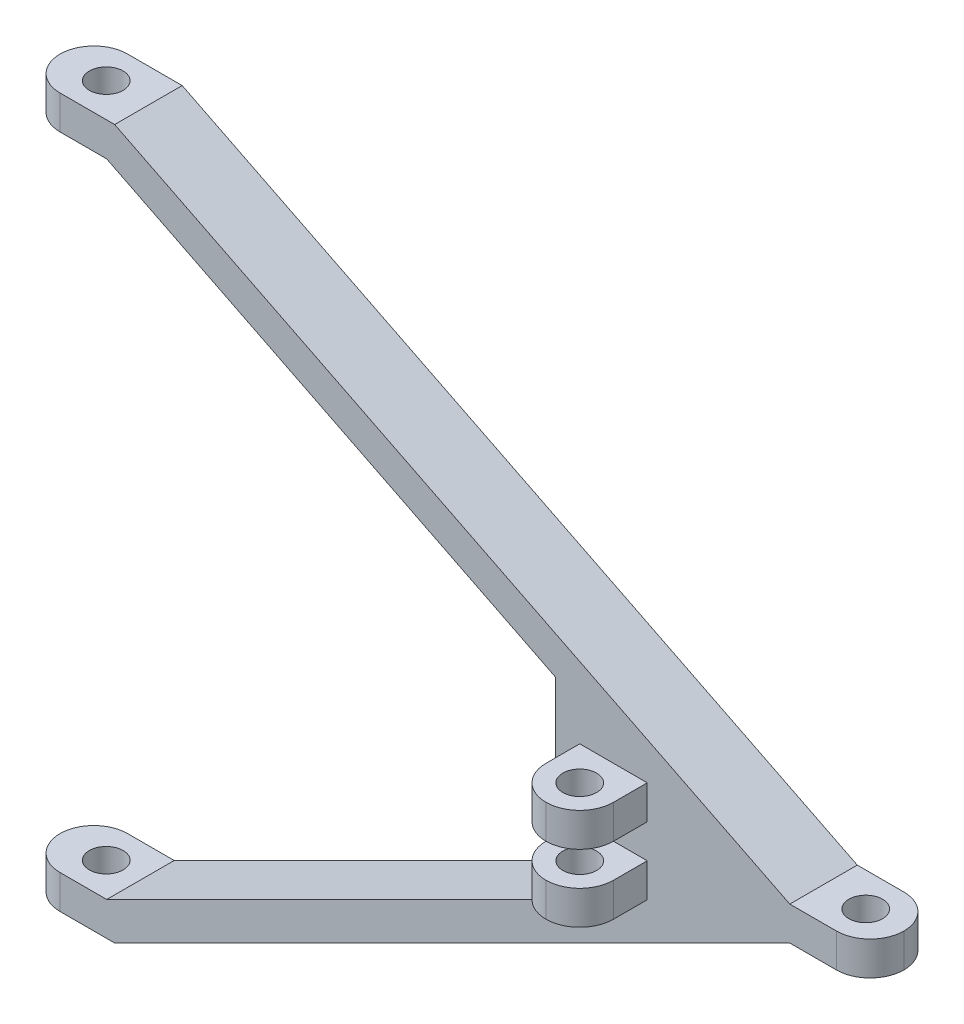
from build123d import *

# Parameters (mm, degrees)
EXTRUDE_THIN4_DEPTH = 20
SKETCH2_R           = 5
CUT_EXTRUDE1_DEPTH  = 235
BOSS_EXTRUDE1_DEPTH = 20
SKETCH4_W           = 20
SKETCH4_H           = 10
BOSS_EXTRUDE2_DEPTH = 20
SKETCH5_R           = 5
CUT_EXTRUDE2_DEPTH  = 160
FILLET1_R           = 10


# Read off the part's stored shape, not the designer's step: Extrude-Thin4
with BuildPart() as part:
    # Extrude-Thin4 outline → Extrude-Thin4 (new body)
    with BuildSketch(Plane.XY):
        Polygon((201.180339887, 5), (1.180339887, 105), (-25, 105), (-25, 95), (-1.180339887, 95), (188.819660113, 0), (-1.180339887, -95), (-25, -95), (-25, -105), (1.180339887, -105), (201.180339887, -5), (225, -5), (225, 5), align=None)
    extrude(amount=EXTRUDE_THIN4_DEPTH)

    # Sketch2 → Cut-Extrude1 (cut)
    with BuildSketch(Plane.XZ.offset(105)):
        with Locations(Location((-11.319660113, 10, 0), (0, 0, 270))):
            Circle(SKETCH2_R)
        with Locations(Location((213.680339887, 10, 0), (0, 0, 180))):
            Circle(SKETCH2_R)
    extrude(amount=-CUT_EXTRUDE1_DEPTH, mode=Mode.SUBTRACT)

    # Sketch3 → Boss-Extrude1 (add)
    with BuildSketch(Plane.XY.offset(20)):
        Polygon((131.729669907, -39.72533499), (131.729669907, 39.72533499), (190.16352069, 10.508409599), (190.16352069, -10.508409599), align=None)
    extrude(amount=-BOSS_EXTRUDE1_DEPTH)

    # Sketch4 → Boss-Extrude2 (add)
    with BuildSketch(Plane.XY.offset(20)):
        with Locations((148.953623882, -10)):
            Rectangle(SKETCH4_W, SKETCH4_H)
        with Locations((148.953623882, 10)):
            Rectangle(SKETCH4_W, SKETCH4_H)
    extrude(amount=BOSS_EXTRUDE2_DEPTH)

    # Sketch5 → Cut-Extrude2 (cut)
    with BuildSketch(Plane.XZ.offset(15)):
        with Locations(Location((148.953623882, 30, 0), (0, 0, 270))):
            Circle(SKETCH5_R)
    extrude(amount=-CUT_EXTRUDE2_DEPTH, mode=Mode.SUBTRACT)

    # Fillet1
    fillet1_edges = [part.edges().sort_by_distance(p)[0] for p in [
        (225, 0, 0),
        (225, 0, 20),
        (-25, 100, 0),
        (-25, 100, 20),
        (-25, -100, 0),
        (-25, -100, 20),
        (138.953623882, 10, 40),
        (158.953623882, 10, 40),
        (158.953623882, -10, 40),
        (138.953623882, -10, 40),
    ]]
    fillet(fillet1_edges, radius=FILLET1_R - 0.0001)  # a hair under: the kernel refuses the full size


solid = part.part
